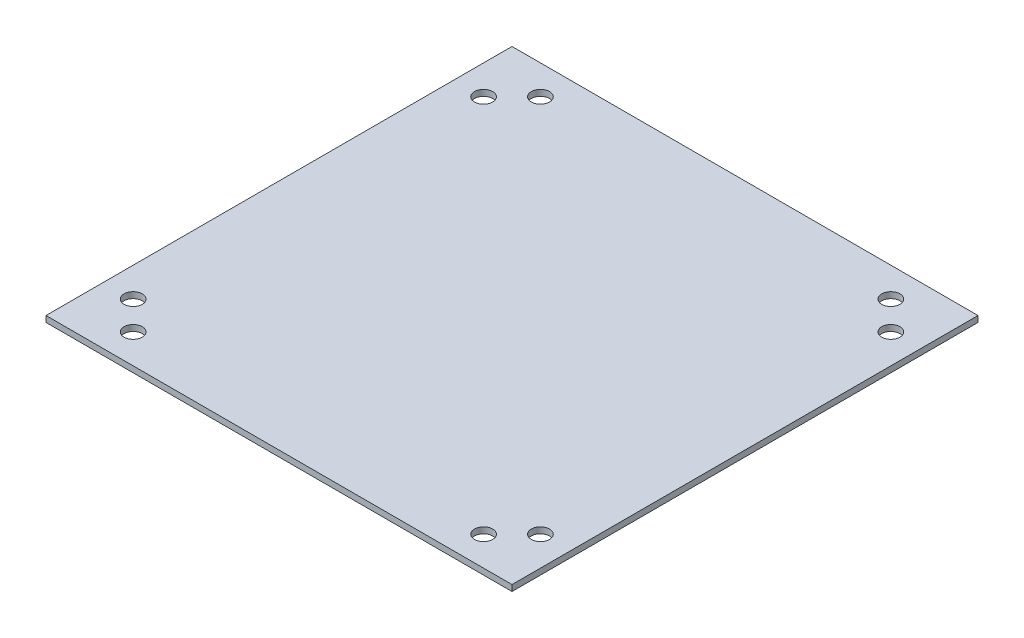
from build123d import *

# Parameters (mm, degrees)
BOSS_EXTRUDE1_DEPTH = 1.3
SKETCH3_W           = 100
SKETCH3_H           = 100
BOSS_EXTRUDE3_DEPTH = 1.3
SKETCH2_R           = 1.95
CUT_EXTRUDE1_DEPTH  = 1.3


with BuildPart() as part:
    # Sketch1 → Boss-Extrude1 (new body)
    with BuildSketch(Plane(origin=(0, 0, 0), x_dir=(1, 0, 0), z_dir=(0, 1, 0))):
        Polygon((7.2, 7.2), (7.2, 0), (90.2, 0), (90.2, 7.2), (97.4, 7.2), (97.4, 90.2), (90.2, 90.2), (90.2, 97.4), (7.2, 97.4), (7.2, 90.2), (0, 90.2), (0, 7.2), align=None)
    extrude(amount=BOSS_EXTRUDE1_DEPTH)

    # Sketch3 → Boss-Extrude3 (add)
    with BuildSketch(Plane(origin=(0, 1.3, 0), x_dir=(1, 0, 0), z_dir=(0, 1, 0))):
        with Locations((48.7, 48.7)):
            Rectangle(SKETCH3_W, SKETCH3_H)
    extrude(amount=-BOSS_EXTRUDE3_DEPTH)

    # Sketch2 → Cut-Extrude1 (cut)
    with BuildSketch(Plane.XZ):
        with Locations((92.4, -86.3)):
            Circle(SKETCH2_R)
        with Locations((86.3, -92.4)):
            Circle(SKETCH2_R)
        with Locations((11.1, -92.4)):
            Circle(SKETCH2_R)
        with Locations((5, -86.3)):
            Circle(SKETCH2_R)
        with Locations((5, -11.1)):
            Circle(SKETCH2_R)
        with Locations((11.1, -5)):
            Circle(SKETCH2_R)
        with Locations((86.3, -5)):
            Circle(SKETCH2_R)
        with Locations((92.4, -11.1)):
            Circle(SKETCH2_R)
    extrude(amount=-CUT_EXTRUDE1_DEPTH, mode=Mode.SUBTRACT)


solid = part.part
